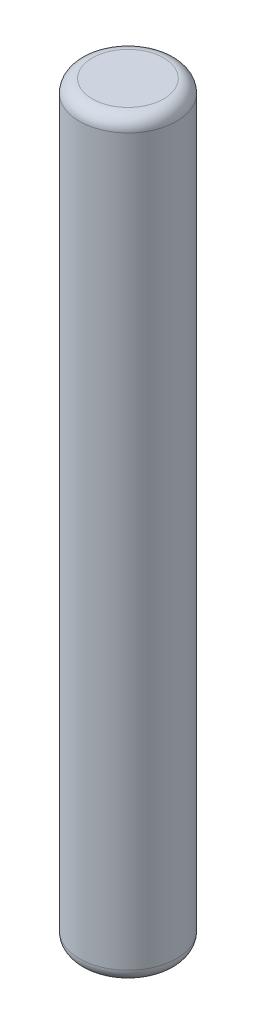
from build123d import *

# Parameters (mm, degrees)
SKETCH_1_R      = 0.375
EXTRUDE_1_DEPTH = 5.8
FILLET_1_R      = 0.1


with BuildPart() as part:
    # Эскиз1 → Бобышка-Вытянуть1 (new body)
    with BuildSketch(Plane(origin=(0, 0, 0), x_dir=(1, 0, 0), z_dir=(0, 1, 0))):
        Circle(SKETCH_1_R)
    extrude(amount=EXTRUDE_1_DEPTH)

    # Скругление1
    fillet_1_edges = [part.edges().sort_by_distance(p)[0] for p in [
        (-0.375, 0, 0),
        (-0.375, 5.8, 0),
    ]]
    fillet(fillet_1_edges, radius=FILLET_1_R)


solid = part.part
